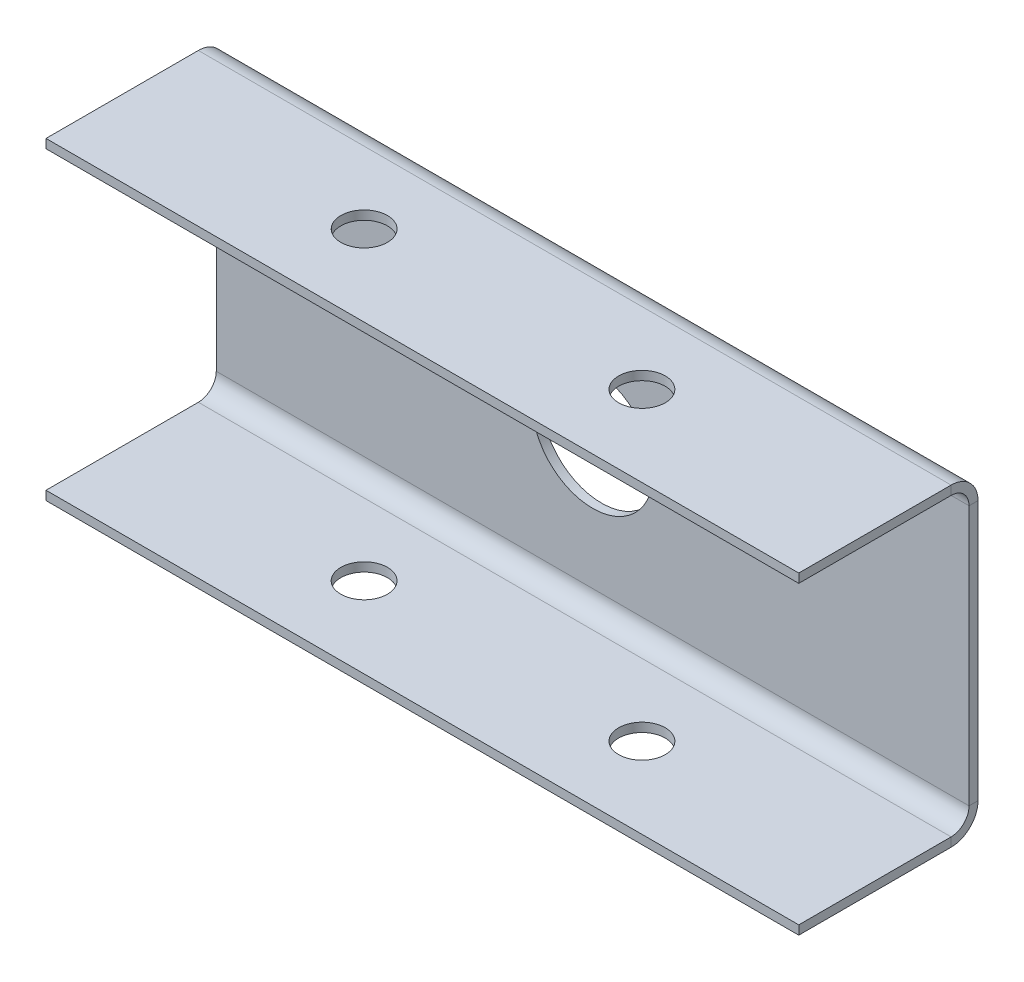
from build123d import *

# Parameters (mm, degrees)
BASE_FLANGE1_DEPTH = 84
SKETCH14_R         = 2.6
CUT_EXTRUDE1_DEPTH = 94.171884171
SKETCH15_R         = 6.75
CUT_EXTRUDE2_DEPTH = 89.103632161


# Sheet-metal steps are written as plain solids
with BuildPart() as part:
    # Sketch3 → Base-Flange1 (new body)
    with BuildSketch(Plane(origin=(0, 0, 0), x_dir=(0, 0, -1), z_dir=(1, 0, 0))):
        with BuildLine():
            Line((-20, 17.5), (-3, 17.5))
            ThreePointArc((-3, 17.5), (-0.878679656, 16.621320344), (0, 14.5))
            Line((0, 14.5), (0, -14.5))
            ThreePointArc((0, -14.5), (-0.878679656, -16.621320344), (-3, -17.5))
            Line((-3, -17.5), (-20, -17.5))
            Line((-20, -17.5), (-20, -16.5))
            Line((-20, -16.5), (-3, -16.5))
            ThreePointArc((-3, -16.5), (-1.585786438, -15.914213562), (-1, -14.5))
            Line((-1, -14.5), (-1, 14.5))
            ThreePointArc((-1, 14.5), (-1.585786438, 15.914213562), (-3, 16.5))
            Line((-3, 16.5), (-20, 16.5))
            Line((-20, 16.5), (-20, 17.5))
        make_face()
    extrude(amount=BASE_FLANGE1_DEPTH)

    # Sketch14 → Cut-Extrude1 (cut, through all)
    with BuildSketch(Plane(origin=(0, 17.5, 0), x_dir=(1, 0, 0), z_dir=(0, 1, 0))):
        with Locations(Location((26.5, -11, 0), (0, 0, 270))):
            Circle(SKETCH14_R)
        with Locations(Location((57.5, -11, 0), (0, 0, 270))):
            Circle(SKETCH14_R)
    extrude(amount=-CUT_EXTRUDE1_DEPTH, mode=Mode.SUBTRACT)

    # Sketch15 → Cut-Extrude2 (cut, through all)
    with BuildSketch(Plane(origin=(0, 0, 0), x_dir=(-1, 0, 0), z_dir=(0, 0, -1))):
        with Locations((-42, 0)):
            Circle(SKETCH15_R)
    extrude(amount=-CUT_EXTRUDE2_DEPTH, mode=Mode.SUBTRACT)


solid = part.part
